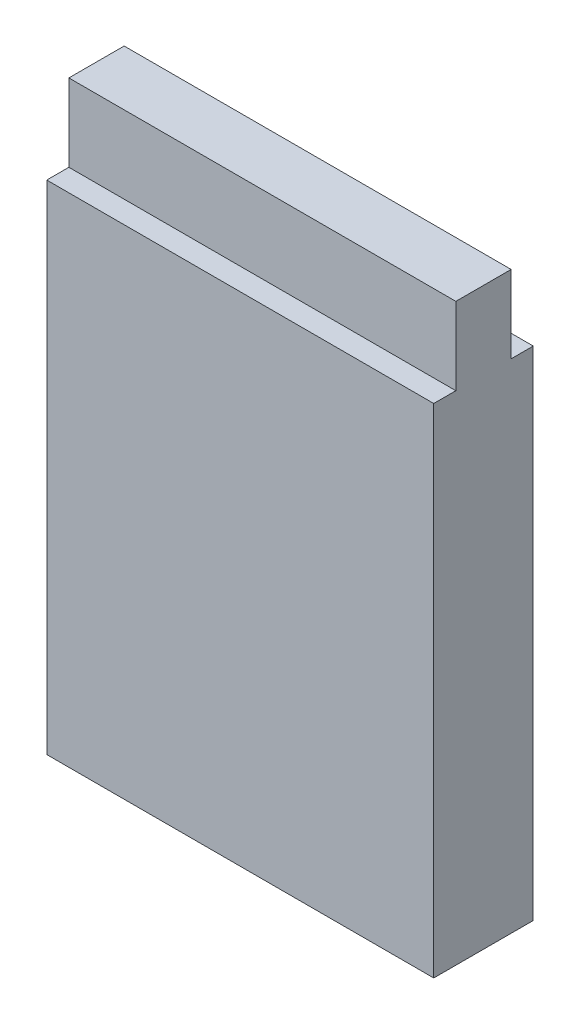
from build123d import *

# Parameters (mm, degrees)
SKETCH1_W           = 35
SKETCH1_H           = 45
BOSS_EXTRUDE1_DEPTH = 4.5
SKETCH3_W           = 35
SKETCH3_H           = 5
BOSS_EXTRUDE2_DEPTH = 7


with BuildPart() as part:
    # Sketch1 → Boss-Extrude1 (new, symmetric)
    with BuildSketch(Plane.XY):
        Rectangle(SKETCH1_W, SKETCH1_H)
    extrude(amount=BOSS_EXTRUDE1_DEPTH, both=True)

    # Sketch3 → Boss-Extrude2 (add)
    with BuildSketch(Plane(origin=(0, 22.5, 0), x_dir=(1, 0, 0), z_dir=(0, 1, 0))):
        Rectangle(SKETCH3_W, SKETCH3_H)
    extrude(amount=BOSS_EXTRUDE2_DEPTH)


solid = part.part
